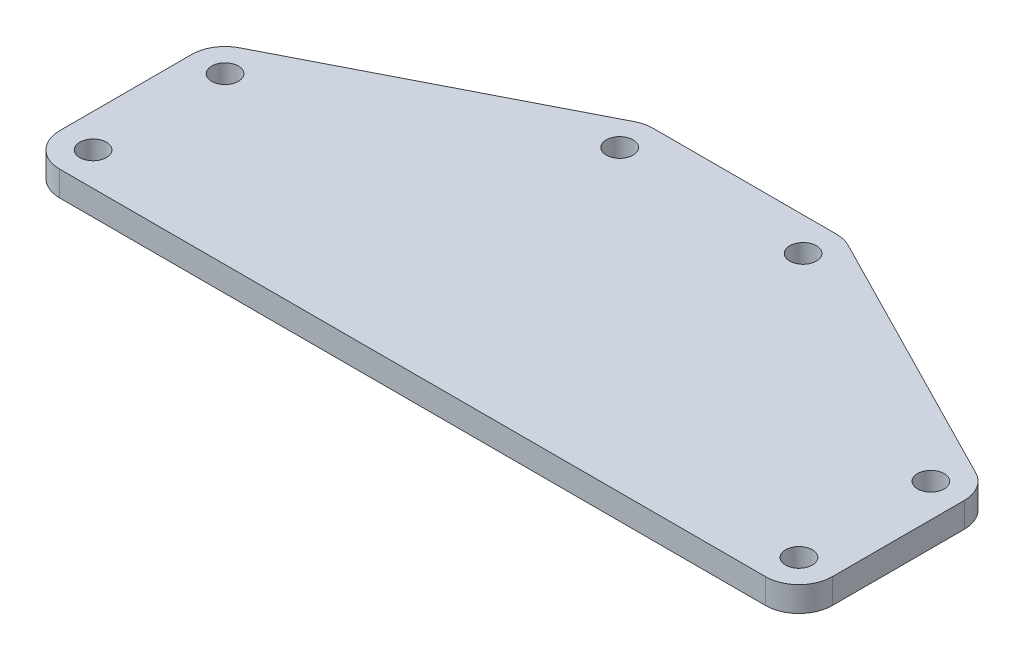
from build123d import *

# Parameters (mm, degrees)
SKETCH1_R           = 1.6
BOSS_EXTRUDE1_DEPTH = 3


with BuildPart() as part:
    # Sketch1 → Boss-Extrude1 (new body)
    with BuildSketch(Plane(origin=(0, 0, 0), x_dir=(1, 0, 0), z_dir=(0, 1, 0))):
        with BuildLine():
            Line((-46.325, -31.824989817), (-46.325, -15.999989817))
            ThreePointArc((-46.325, -15.999989817), (-45.736595381, -13.911685012), (-44.144491522, -12.437764304))
            Line((-44.144491522, -12.437764304), (-12.819491522, 3.562225512))
            ThreePointArc((-12.819491522, 3.562225512), (-11.93570774, 3.889016717), (-11, 4))
            Line((-11, 4), (11, 4))
            ThreePointArc((11, 4), (11.93570774, 3.889016717), (12.819491522, 3.562225512))
            Line((12.819491522, 3.562225512), (44.144491522, -12.437764304))
            ThreePointArc((44.144491522, -12.437764304), (45.736595381, -13.911685012), (46.325, -15.999989817))
            Line((46.325, -15.999989817), (46.325, -31.824989817))
            ThreePointArc((46.325, -31.824989817), (45.153427125, -34.653416941), (42.325, -35.824989817))
            Line((42.325, -35.824989817), (-42.325, -35.824989817))
            ThreePointArc((-42.325, -35.824989817), (-45.153427125, -34.653416941), (-46.325, -31.824989817))
        make_face()
        with Locations((-42.325, -31.824989817)):
            Circle(SKETCH1_R, mode=Mode.SUBTRACT)
        with Locations((-42.325, -15.999989817)):
            Circle(SKETCH1_R, mode=Mode.SUBTRACT)
        with Locations((42.325, -31.824989817)):
            Circle(SKETCH1_R, mode=Mode.SUBTRACT)
        with Locations((42.325, -15.999989817)):
            Circle(SKETCH1_R, mode=Mode.SUBTRACT)
        with Locations((-11, 0)):
            Circle(SKETCH1_R, mode=Mode.SUBTRACT)
        with Locations((11, 0)):
            Circle(SKETCH1_R, mode=Mode.SUBTRACT)
    extrude(amount=BOSS_EXTRUDE1_DEPTH)


solid = part.part
